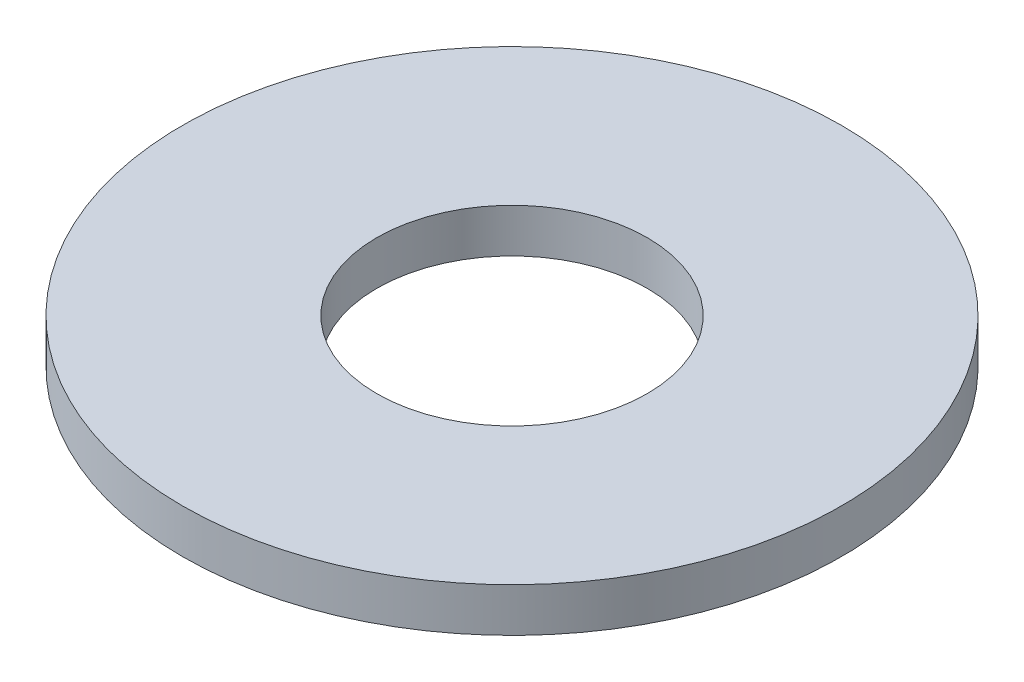
from build123d import *

# Parameters (mm, degrees)
SKETCH1_R           = 97.5
BOSS_EXTRUDE1_DEPTH = 13
SKETCH2_R           = 40
CUT_EXTRUDE1_DEPTH  = 139.497292392


with BuildPart() as part:
    # Sketch1 → Boss-Extrude1 (new body)
    with BuildSketch(Plane(origin=(0, 0, 0), x_dir=(1, 0, 0), z_dir=(0, 1, 0))):
        Circle(SKETCH1_R)
    extrude(amount=BOSS_EXTRUDE1_DEPTH)

    # Sketch2 → Cut-Extrude1 (cut, through all)
    with BuildSketch(Plane(origin=(0, 0, 0), x_dir=(1, 0, 0), z_dir=(0, 1, 0))):
        Circle(SKETCH2_R)
    extrude(amount=CUT_EXTRUDE1_DEPTH, mode=Mode.SUBTRACT)


solid = part.part
